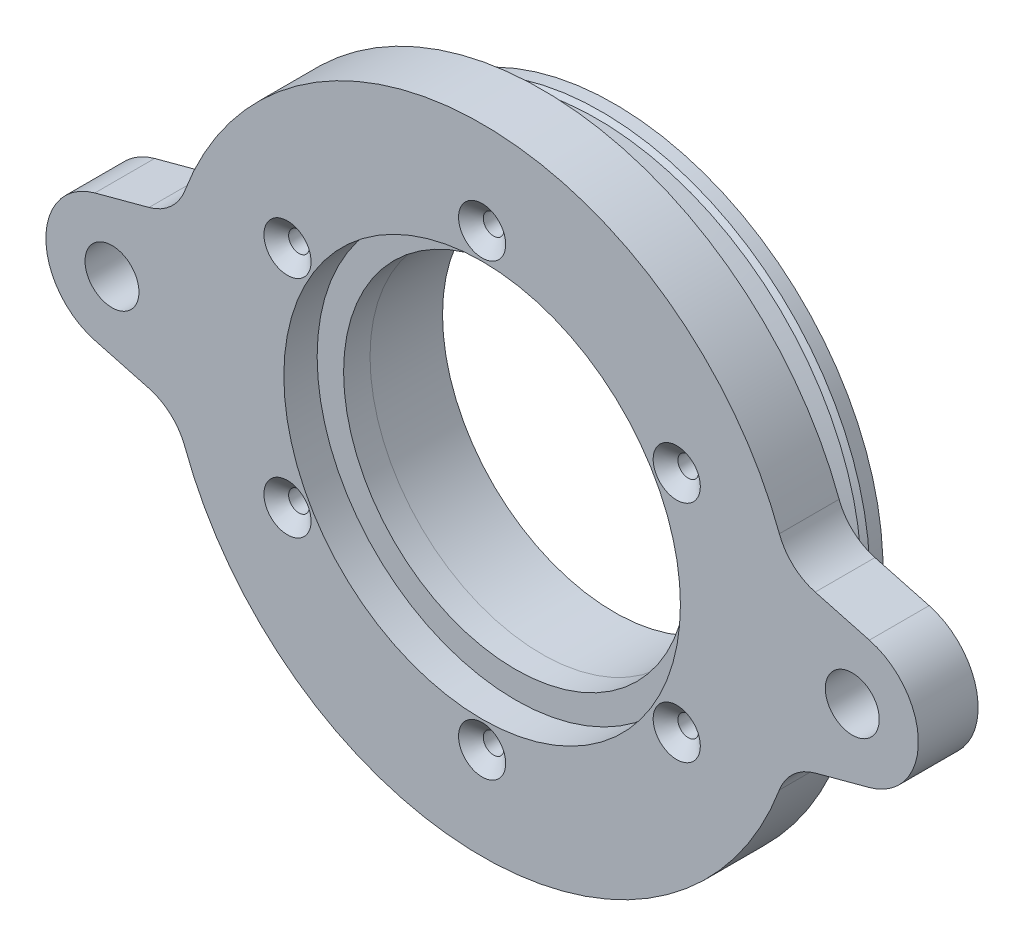
from build123d import *

# Parameters (mm, degrees)
SKETCH2_R                     = 47.625
SKETCH2_R_2                   = 6.477
BOSS_EXTRUDE1_DEPTH           = 14.351
FILLET2_R                     = 12.7
SKETCH3_R                     = 47.625
SKETCH3_R_2                   = 41.275
BOSS_EXTRUDE2_DEPTH           = 6.35
SKETCH4_R                     = 2.4892
CUT_EXTRUDE1_DEPTH            = 22.225
CHAMFER1_SIZE                 = 3.175
CHAMFER1_SIZE2                = 2.759985393
CIRPATTERN1_COUNT             = 6
CHAMFER1_OF_CIRPATTERN1_SIZE2 = 2.759985393
CHAMFER1_OF_CIRPATTERN1_SIZE  = 3.175


with BuildPart() as part:
    # Sketch1 → Revolve1 (revolve)
    with BuildSketch(Plane(origin=(0, 0, 0), x_dir=(0, 0, -1), z_dir=(1, 0, 0))):
        Polygon((0, 41.275), (0, 53.1876), (-0.963627649, 53.1876), (-4.514471728, 63.5), (-5.530471728, 64.516), (-8.705471728, 64.516), (-8.705471728, 41.275), align=None)
    revolve1 = revolve(axis=Axis((0, 0, 0), (0, 0, 1)))

    # Mirror1: Revolve1 across plane
    add(revolve1.mirror(Plane(origin=(0, 0, 0), x_dir=(1, 0, 0), z_dir=(0, 0, -1))))

    # Sketch2 → Boss-Extrude1 (add)
    with BuildSketch(Plane.XY.offset(8.705471728)):
        with BuildLine():
            ThreePointArc((73.363199176, 20.598082598), (0, 76.2), (-73.363199176, 20.598082598))
            Line((-73.363199176, 20.598082598), (-93.008752341, 15.334072492))
            ThreePointArc((-93.008752341, 15.334072492), (-104.775, 0), (-93.008752341, -15.334072492))
            Line((-93.008752341, -15.334072492), (-73.363199176, -20.598082598))
            ThreePointArc((-73.363199176, -20.598082598), (0, -76.2), (73.363199176, -20.598082598))
            Line((73.363199176, -20.598082598), (93.008752341, -15.334072492))
            ThreePointArc((93.008752341, -15.334072492), (104.775, 0), (93.008752341, 15.334072492))
            Line((93.008752341, 15.334072492), (73.363199176, 20.598082598))
        make_face()
        Circle(SKETCH2_R, mode=Mode.SUBTRACT)
        with Locations((-88.9, 0)):
            Circle(SKETCH2_R_2, mode=Mode.SUBTRACT)
        with Locations((88.9, 0)):
            Circle(SKETCH2_R_2, mode=Mode.SUBTRACT)
    extrude(amount=BOSS_EXTRUDE1_DEPTH)

    # Fillet2
    fillet2_edges = [part.edges().sort_by_distance(p)[0] for p in [
        (73.363199176, -20.598082598, 15.880971728),
        (73.363199176, 20.598082598, 15.880971728),
        (-73.363199176, 20.598082598, 15.880971728),
        (-73.363199176, -20.598082598, 15.880971728),
    ]]
    fillet(fillet2_edges, radius=FILLET2_R)

    # Sketch3 → Boss-Extrude2 (add)
    with BuildSketch(Plane.XY.offset(8.705471728)):
        Circle(SKETCH3_R)
        Circle(SKETCH3_R_2, mode=Mode.SUBTRACT)
    extrude(amount=BOSS_EXTRUDE2_DEPTH)

    # Sketch4 → Cut-Extrude1 (cut)
    with BuildSketch(Plane.XY.offset(23.056471728)):
        with Locations((0, 53.975)):
            Circle(SKETCH4_R)
    cut_extrude1 = extrude(amount=-CUT_EXTRUDE1_DEPTH, mode=Mode.SUBTRACT)

    # Chamfer1
    chamfer1_edges = [part.edges().sort_by_distance(p)[0] for p in [
        (-2.4892, 53.975, 23.056471728),
    ]]
    chamfer1_side = [part.faces().sort_by_distance(p)[0] for p in [
        (85.834031464, 14.574049615, 23.056471728),
    ]]
    chamfer(chamfer1_edges, length=CHAMFER1_SIZE, length2=CHAMFER1_SIZE2, reference=chamfer1_side[0])

    # CirPattern1: Cut-Extrude1 ×6 about axis
    cirpattern1_axis = Axis((0, 0, 23.056471728), (0, 0, 1))
    for i in range(1, CIRPATTERN1_COUNT):
        add(cut_extrude1.rotate(cirpattern1_axis, i * 360 / CIRPATTERN1_COUNT), mode=Mode.SUBTRACT)

    # Chamfer1 of CirPattern1
    chamfer1_of_cirpattern1_edges = [part.edges().sort_by_distance(p)[0] for p in [
        (-47.988321169, 24.831789565, 23.056471728),
        (-45.499121169, -29.143210435, 23.056471728),
        (2.4892, -53.975, 23.056471728),
        (47.988321169, -24.831789565, 23.056471728),
        (45.499121169, 29.143210435, 23.056471728),
    ]]
    chamfer(chamfer1_of_cirpattern1_edges, length=CHAMFER1_OF_CIRPATTERN1_SIZE, length2=CHAMFER1_OF_CIRPATTERN1_SIZE2)


with BuildPart() as body_2:
    # Split1: the piece on the far side of the plane
    add(part.part)
    split(bisect_by=Plane(origin=(0, 0, 8.705471728), x_dir=(-1, 0, 0), z_dir=(0, 0, -1)), keep=Keep.BOTTOM)


with BuildPart() as part_1:
    add(part.part)

    # Split1
    split(bisect_by=Plane(origin=(0, 0, 8.705471728), x_dir=(-1, 0, 0), z_dir=(0, 0, -1)), keep=Keep.TOP)


solid = Compound([body_2.part, part_1.part])
